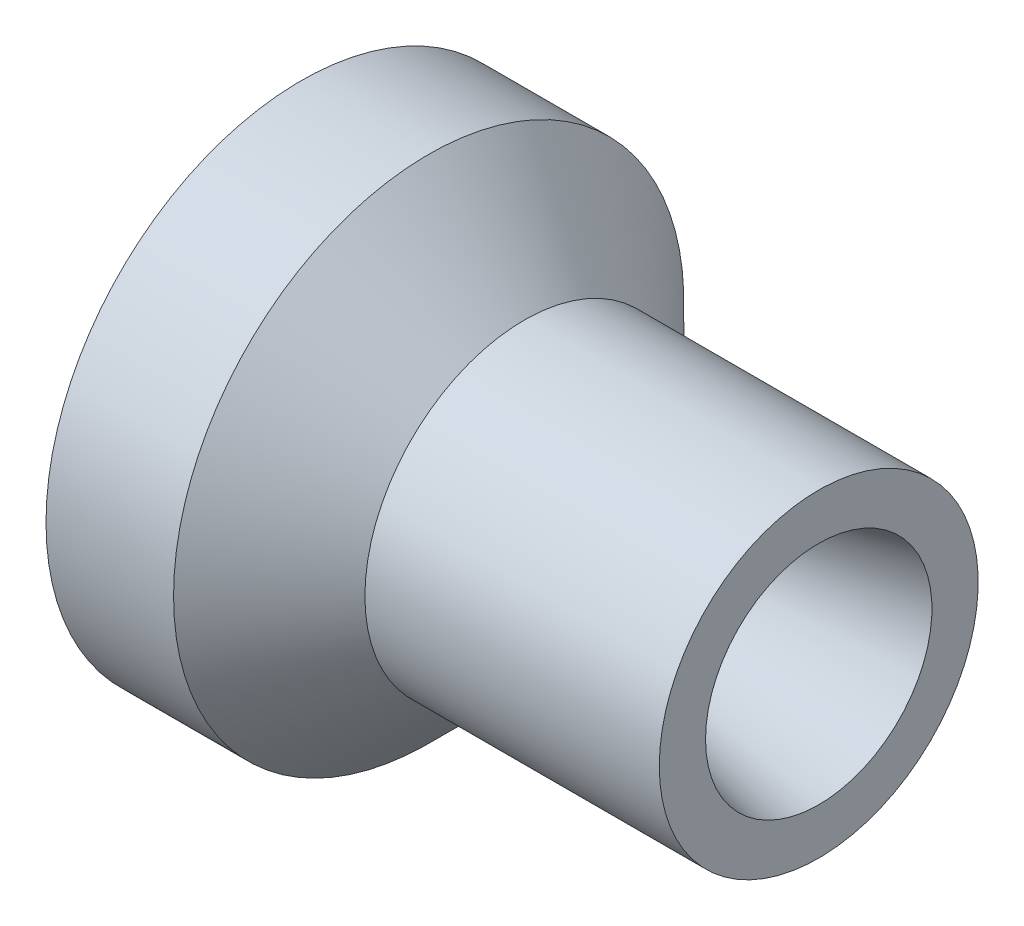
from build123d import *


with BuildPart() as part:
    # Sketch1 → Revolve1 (revolve)
    with BuildSketch(Plane.XY):
        Polygon((103.071618259, 28.575), (103.071618259, 37.7825), (46.609, 49.784), (40.259, 49.784), (0, 9.525), (25.4, 9.525), (44.45, 28.575), align=None)
    revolve(axis=Axis((0, 60.325, 0), (1, 0, 0)))


solid = part.part
